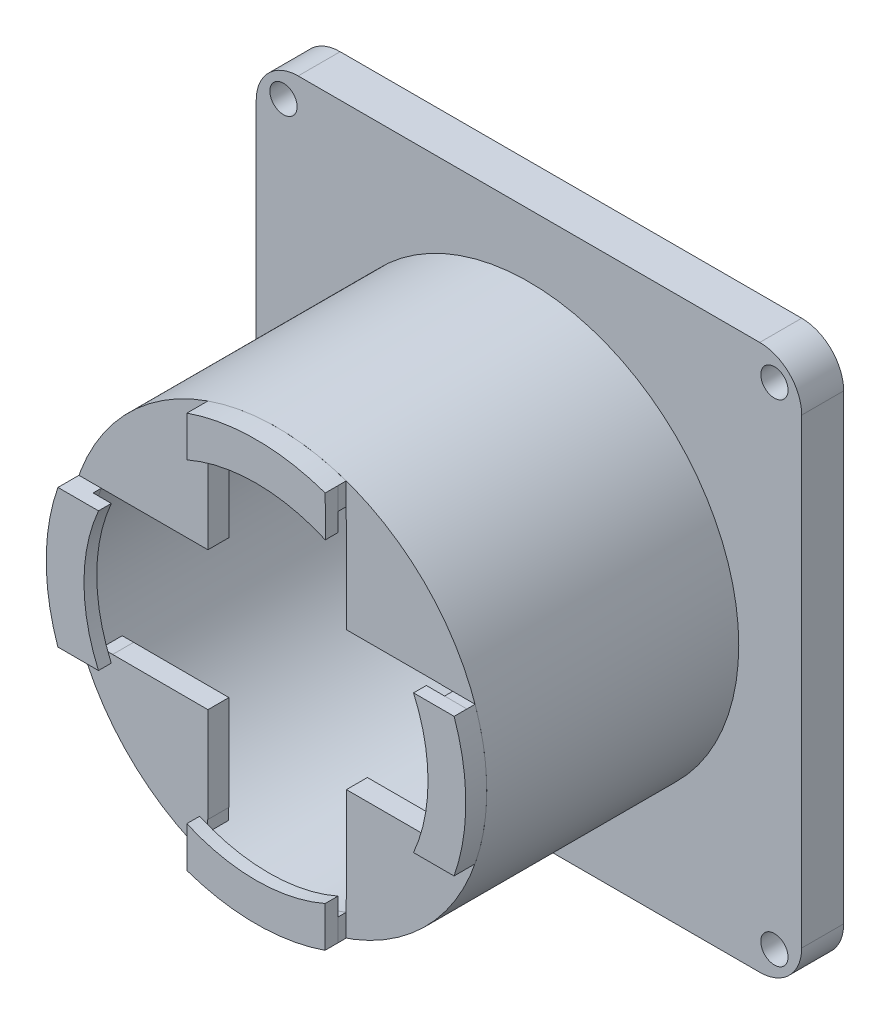
from build123d import *
from build123d.topology import SkipClean

# Parameters (mm, degrees)
DODANIE_WYCI_GNI_CIE2_DEPTH = 10
SZKIC2_R                    = 50
SZKIC2_R_2                  = 45
DODANIE_WYCI_GNI_CIE3_DEPTH = 55.05
SZKIC4_R                    = 3.25
WYTNIJ_WYCI_GNI_CIE2_DEPTH  = 55
DODANIE_WYCI_GNI_CIE4_DEPTH = 5
SZKIC8_R                    = 45
WYTNIJ_WYCI_GNI_CIE3_DEPTH  = 110.799829235
DODANIE_WYCI_GNI_CIE5_DEPTH = 10
DODANIE_WYCI_GNI_CIE6_START = -3.05
DODANIE_WYCI_GNI_CIE6_DEPTH = 3.05
PODZIEL1_OUTLINE_R          = 3.25
PODZIEL1_OUTLINE_R_2        = 45
PODZIEL1_DEPTH              = 10
PODZIEL1_2_OUTLINE_R        = 3.25
PODZIEL1_2_DEPTH            = 10
PODZIEL1_START              = 70.05
PODZIEL1_3_OUTLINE_R        = 3.25
PODZIEL1_3_DEPTH            = 5
PODZIEL1_START_2            = 72
PODZIEL1_4_DEPTH            = 3.05
PODZIEL1_5_DEPTH            = 1.95
PODZIEL1_6_DEPTH            = 3.05
PODZIEL1_7_DEPTH            = 1.95
PODZIEL1_8_DEPTH            = 3.05
PODZIEL1_9_DEPTH            = 1.95
PODZIEL1_10_DEPTH           = 3.05
PODZIEL1_11_DEPTH           = 1.95


# Read off the part's stored shape, not the designer's step: Podziel1
with BuildPart() as part:
    # Szkic1 → Dodanie-wyciągnięcie2 (new body)
    with BuildSketch(Plane.XY):
        with BuildLine():
            Line((-55, 65), (55, 65))
            ThreePointArc((55, 65), (62.071067812, 62.071067812), (65, 55))
            Line((65, 55), (65, -55))
            ThreePointArc((65, -55), (62.071067812, -62.071067812), (55, -65))
            Line((55, -65), (-55, -65))
            ThreePointArc((-55, -65), (-62.071067812, -62.071067812), (-65, -55))
            Line((-65, -55), (-65, 55))
            ThreePointArc((-65, 55), (-62.071067812, 62.071067812), (-55, 65))
        make_face()
    extrude(amount=DODANIE_WYCI_GNI_CIE2_DEPTH)

    # Szkic2 → Dodanie-wyciągnięcie3 (add)
    with BuildSketch(Plane.XY.offset(10)):
        Circle(SZKIC2_R)
        Circle(SZKIC2_R_2, mode=Mode.SUBTRACT)
    extrude(amount=DODANIE_WYCI_GNI_CIE3_DEPTH)

    # Szkic4 → Wytnij-wyciągnięcie2 (cut)
    with BuildSketch(Plane.XY.offset(10)):
        with Locations((-58.5, 58.5)):
            Circle(SZKIC4_R)
        with Locations((58.5, 58.5)):
            Circle(SZKIC4_R)
        with Locations((58.5, -58.5)):
            Circle(SZKIC4_R)
        with Locations((-58.5, -58.5)):
            Circle(SZKIC4_R)
    extrude(amount=-WYTNIJ_WYCI_GNI_CIE2_DEPTH, mode=Mode.SUBTRACT)

    # Szkic7 → Dodanie-wyciągnięcie4 (add)
    with BuildSketch(Plane.XY.offset(65.05)):
        with BuildLine():
            Line((-16.455530898, 16.5), (-16.455530898, 47.214568757))
            ThreePointArc((-16.455530898, 47.214568757), (-35.338682666, 35.371987609), (-47.199046601, 16.5))
            Line((-47.199046601, 16.5), (-16.455530898, 16.5))
        make_face()
        with BuildLine():
            ThreePointArc((16.5, 39.185016306), (16.522237205, 39.17567049), (16.544469102, 39.166312055))
            Line((16.544469102, 39.166312055), (16.544469102, 16.5))
            Line((16.544469102, 16.5), (39.210781157, 16.5))
            ThreePointArc((39.210781157, 16.5), (39.220139592, 16.477768103), (39.229485408, 16.455530898))
            Line((39.229485408, 16.455530898), (47.214568757, 16.455530898))
            ThreePointArc((47.214568757, 16.455530898), (35.371987609, 35.338682666), (16.5, 47.199046601))
            Line((16.5, 47.199046601), (16.5, 39.185016306))
        make_face()
        with BuildLine():
            ThreePointArc((-16.5, -39.147548354), (-16.477768113, -39.156936517), (-16.455530898, -39.166312055))
            Line((-16.455530898, -39.166312055), (-16.455530898, -16.5))
            Line((-16.455530898, -16.5), (-39.166312055, -16.455530898))
            Line((-39.166312055, -16.455530898), (-47.214568757, -16.455530898))
            ThreePointArc((-47.214568757, -16.455530898), (-35.371987609, -35.338682666), (-16.5, -47.199046601))
            Line((-16.5, -47.199046601), (-16.5, -39.147548354))
        make_face()
        with BuildLine():
            Line((16.544469102, -16.5), (16.544469102, -39.166312055))
            ThreePointArc((16.544469102, -39.166312055), (16.500010596, -39.185011856), (16.455530898, -39.20366119))
            Line((16.455530898, -39.20366119), (16.455530898, -47.214568757))
            ThreePointArc((16.455530898, -47.214568757), (35.338682666, -35.371987609), (47.199046601, -16.5))
            Line((47.199046601, -16.5), (16.544469102, -16.5))
        make_face()
    extrude(amount=DODANIE_WYCI_GNI_CIE4_DEPTH)

    # Szkic8 → Wytnij-wyciągnięcie3 (cut, through all)
    with SkipClean():  # the faces are left unmerged after this step: merging them gives an invalid solid
        with BuildSketch(Plane.XY.offset(10)):
            with Locations(Location((0, 0, 0), (0, 0, 201.449342522))):
                Circle(SZKIC8_R)
        extrude(amount=-WYTNIJ_WYCI_GNI_CIE3_DEPTH, mode=Mode.SUBTRACT)
    add(part.part.scale(1), mode=Mode.REPLACE)  # the faces are merged on a copy

    # Szkic9 → Dodanie-wyciągnięcie5 (add)
    with SkipClean():  # the faces are left unmerged after this step: merging them gives an invalid solid
        with BuildSketch(Plane.XY.offset(65.05)):
            with BuildLine():
                Line((-41.883355917, -16.455530898), (-47.214568757, -16.455530898))
                ThreePointArc((-47.214568757, -16.455530898), (-49.999994454, 0.023550151), (-47.199046601, 16.5))
                Line((-47.199046601, 16.5), (-41.865857211, 16.5))
                ThreePointArc((-41.865857211, 16.5), (-44.999993656, 0.023894067), (-41.883355917, -16.455530898))
            make_face()
            with BuildLine():
                Line((16.455530898, -41.883355917), (16.455530898, -47.214568757))
                ThreePointArc((16.455530898, -47.214568757), (-0.023550151, -49.999994454), (-16.5, -47.199046601))
                Line((-16.5, -47.199046601), (-16.5, -41.865857211))
                ThreePointArc((-16.5, -41.865857211), (-0.023894067, -44.999993656), (16.455530898, -41.883355917))
            make_face()
            with BuildLine():
                Line((41.865857211, -16.5), (47.199046601, -16.5))
                ThreePointArc((47.199046601, -16.5), (49.999994454, -0.023550151), (47.214568757, 16.455530898))
                Line((47.214568757, 16.455530898), (41.883355917, 16.455530898))
                ThreePointArc((41.883355917, 16.455530898), (44.999993656, -0.023894067), (41.865857211, -16.5))
            make_face()
            with BuildLine():
                Line((16.5, 41.865857211), (16.5, 47.199046601))
                ThreePointArc((16.5, 47.199046601), (0.023550151, 49.999994454), (-16.455530898, 47.214568757))
                Line((-16.455530898, 47.214568757), (-16.455530898, 41.883355917))
                ThreePointArc((-16.455530898, 41.883355917), (0.023894067, 44.999993656), (16.5, 41.865857211))
            make_face()
        extrude(amount=DODANIE_WYCI_GNI_CIE5_DEPTH)

    # Szkic10 → Dodanie-wyciągnięcie6 (add)
    with SkipClean():  # the faces are left unmerged after this step: merging them gives an invalid solid
        with BuildSketch(Plane.XY.offset(75.05).offset(DODANIE_WYCI_GNI_CIE6_START)):
            with BuildLine():
                Line((-37.546708344, -16.469507963), (-47.214568757, -16.455530898))
                ThreePointArc((-47.214568757, -16.455530898), (-49.999994454, 0.023550151), (-47.199046601, 16.5))
                Line((-47.199046601, 16.5), (-37.533318532, 16.5))
                ThreePointArc((-37.533318532, 16.5), (-40.999996619, 0.016651212), (-37.546708344, -16.469507963))
            make_face()
            with BuildLine():
                Line((-16.5, -47.199046601), (-16.486007616, -37.539466604))
                ThreePointArc((-16.486007616, -37.539466604), (-0.001345704, -40.999999978), (16.483543336, -37.540548732))
                Line((16.483543336, -37.540548732), (16.455530898, -47.214568757))
                ThreePointArc((16.455530898, -47.214568757), (-0.023550151, -49.999994454), (-16.5, -47.199046601))
            make_face()
            with BuildLine():
                Line((47.199046601, -16.5), (37.533318532, -16.5))
                ThreePointArc((37.533318532, -16.5), (40.999996628, -0.016629068), (37.546690554, 16.46954852))
                Line((37.546690554, 16.46954852), (47.214568757, 16.455530898))
                ThreePointArc((47.214568757, 16.455530898), (49.999994454, -0.023550151), (47.199046601, -16.5))
            make_face()
            with BuildLine():
                Line((-16.455530898, 47.214568757), (-16.455530898, 37.552836149))
                ThreePointArc((-16.455530898, 37.552836149), (0.031934624, 40.999987563), (16.514010216, 37.527156388))
                Line((16.514010216, 37.527156388), (16.5, 47.199046601))
                ThreePointArc((16.5, 47.199046601), (0.023550151, 49.999994454), (-16.455530898, 47.214568757))
            make_face()
        extrude(amount=DODANIE_WYCI_GNI_CIE6_DEPTH)

    # Podziel1 2 outline → Podziel1 2 (cut)
    with SkipClean():  # the faces are left unmerged after this step: merging them gives an invalid solid
        with BuildSketch(Plane.XY):
            with BuildLine():
                ThreePointArc((-65, -55), (-62.071067812, -62.071067812), (-55, -65))
                Line((-55, -65), (55, -65))
                ThreePointArc((55, -65), (62.071067812, -62.071067812), (65, -55))
                Line((65, -55), (65, 55))
                ThreePointArc((65, 55), (62.071067812, 62.071067812), (55, 65))
                Line((55, 65), (-55, 65))
                ThreePointArc((-55, 65), (-62.071067812, 62.071067812), (-65, 55))
                Line((-65, 55), (-65, -55))
            make_face()
            with BuildLine():
                ThreePointArc((41.865857211, -16.5), (17.936369644, -41.270893424), (-16.5, -41.865857211))
                ThreePointArc((-16.5, -41.865857211), (-41.270893424, -17.936369644), (-41.865857211, 16.5))
                ThreePointArc((-41.865857211, 16.5), (-31.802905011, 31.836696325), (-16.455530898, 41.883355917))
                ThreePointArc((-16.455530898, 41.883355917), (31.836696325, 31.802905011), (41.865857211, -16.5))
            make_face(mode=Mode.SUBTRACT)
            with Locations((-58.5, -58.5)):
                Circle(PODZIEL1_2_OUTLINE_R, mode=Mode.SUBTRACT)
            with Locations((58.5, -58.5)):
                Circle(PODZIEL1_2_OUTLINE_R, mode=Mode.SUBTRACT)
            with Locations((-58.5, 58.5)):
                Circle(PODZIEL1_2_OUTLINE_R, mode=Mode.SUBTRACT)
            with Locations((58.5, 58.5)):
                Circle(PODZIEL1_2_OUTLINE_R, mode=Mode.SUBTRACT)
        extrude(amount=PODZIEL1_2_DEPTH, mode=Mode.SUBTRACT)

    # Podziel1 3 outline → Podziel1 3 (cut)
    with SkipClean():  # the faces are left unmerged after this step: merging them gives an invalid solid
        with BuildSketch(Plane.XY.offset(PODZIEL1_START)):
            with BuildLine():
                ThreePointArc((-65, -55), (-62.071067812, -62.071067812), (-55, -65))
                Line((-55, -65), (55, -65))
                ThreePointArc((55, -65), (62.071067812, -62.071067812), (65, -55))
                Line((65, -55), (65, 55))
                ThreePointArc((65, 55), (62.071067812, 62.071067812), (55, 65))
                Line((55, 65), (-55, 65))
                ThreePointArc((-55, 65), (-62.071067812, 62.071067812), (-65, 55))
                Line((-65, 55), (-65, -55))
            make_face()
            with BuildLine():
                Line((37.533318532, -16.5), (41.865857211, -16.5))
                ThreePointArc((41.865857211, -16.5), (31.808778722, -31.830827765), (16.47098574, -41.87728058))
                Line((16.47098574, -41.87728058), (16.483543336, -37.540548732))
                ThreePointArc((16.483543336, -37.540548732), (-0.001345704, -40.999999978), (-16.486007616, -37.539466604))
                Line((-16.486007616, -37.539466604), (-16.492279016, -41.868899351))
                ThreePointArc((-16.492279016, -41.868899351), (-16.496139578, -41.867378459), (-16.5, -41.865857211))
                ThreePointArc((-16.5, -41.865857211), (-31.8337682, -31.805835977), (-41.880325193, -16.463242746))
                Line((-41.880325193, -16.463242746), (-37.546708344, -16.469507963))
                ThreePointArc((-37.546708344, -16.469507963), (-40.999996619, 0.016651212), (-37.533318532, 16.5))
                Line((-37.533318532, 16.5), (-41.865857211, 16.5))
                ThreePointArc((-41.865857211, 16.5), (-31.802905011, 31.836696325), (-16.455530898, 41.883355917))
                Line((-16.455530898, 41.883355917), (-16.455530898, 37.552836149))
                ThreePointArc((-16.455530898, 37.552836149), (0.031934624, 40.999987563), (16.514010216, 37.527156388))
                Line((16.514010216, 37.527156388), (16.507729805, 41.862809947))
                ThreePointArc((16.507729805, 41.862809947), (31.836695874, 31.802905462), (41.880316397, 16.463265122))
                Line((41.880316397, 16.463265122), (37.546690554, 16.46954852))
                ThreePointArc((37.546690554, 16.46954852), (40.999996628, -0.016629068), (37.533318532, -16.5))
            make_face(mode=Mode.SUBTRACT)
            with Locations((-58.5, -58.5)):
                Circle(PODZIEL1_3_OUTLINE_R, mode=Mode.SUBTRACT)
            with Locations((58.5, -58.5)):
                Circle(PODZIEL1_3_OUTLINE_R, mode=Mode.SUBTRACT)
            with Locations((-58.5, 58.5)):
                Circle(PODZIEL1_3_OUTLINE_R, mode=Mode.SUBTRACT)
            with Locations((58.5, 58.5)):
                Circle(PODZIEL1_3_OUTLINE_R, mode=Mode.SUBTRACT)
        extrude(amount=PODZIEL1_3_DEPTH, mode=Mode.SUBTRACT)


with BuildPart() as body_2:
    # Podziel1 outline → Podziel1 (new body)
    with BuildSketch(Plane.XY):
        with BuildLine():
            Line((-55, -65), (55, -65))
            ThreePointArc((55, -65), (62.071067812, -62.071067812), (65, -55))
            Line((65, -55), (65, 55))
            ThreePointArc((65, 55), (62.071067812, 62.071067812), (55, 65))
            Line((55, 65), (-55, 65))
            ThreePointArc((-55, 65), (-62.071067812, 62.071067812), (-65, 55))
            Line((-65, 55), (-65, -55))
            ThreePointArc((-65, -55), (-62.071067812, -62.071067812), (-55, -65))
        make_face()
        with Locations((-58.5, -58.5)):
            Circle(PODZIEL1_OUTLINE_R, mode=Mode.SUBTRACT)
        with Locations((58.5, -58.5)):
            Circle(PODZIEL1_OUTLINE_R, mode=Mode.SUBTRACT)
        with Locations((-58.5, 58.5)):
            Circle(PODZIEL1_OUTLINE_R, mode=Mode.SUBTRACT)
        Circle(PODZIEL1_OUTLINE_R_2, mode=Mode.SUBTRACT)
        with Locations((58.5, 58.5)):
            Circle(PODZIEL1_OUTLINE_R, mode=Mode.SUBTRACT)
    extrude(amount=PODZIEL1_DEPTH)


with BuildPart() as body_3:
    # Podziel1 4 outline → Podziel1 4 (new body)
    with BuildSketch(Plane.XY.offset(PODZIEL1_START_2)):
        with BuildLine():
            Line((37.533318532, -16.5), (47.199046601, -16.5))
            ThreePointArc((47.199046601, -16.5), (49.999994454, -0.023550151), (47.214568757, 16.455530898))
            Line((47.214568757, 16.455530898), (37.546690554, 16.46954852))
            ThreePointArc((37.546690554, 16.46954852), (40.999996628, -0.016629068), (37.533318532, -16.5))
        make_face()
    extrude(amount=PODZIEL1_4_DEPTH)

    # Podziel1 5 outline → Podziel1 5 (add)
    with BuildSketch(Plane.XY.offset(PODZIEL1_START)):
        with BuildLine():
            ThreePointArc((47.199046601, -16.5), (49.999994454, -0.023550151), (47.214568757, 16.455530898))
            Line((47.214568757, 16.455530898), (41.883355917, 16.455530898))
            ThreePointArc((41.883355917, 16.455530898), (44.999993656, -0.023894067), (41.865857211, -16.5))
            Line((41.865857211, -16.5), (47.199046601, -16.5))
        make_face()
    extrude(amount=PODZIEL1_5_DEPTH)


with BuildPart() as body_4:
    # Podziel1 6 outline → Podziel1 6 (new body)
    with BuildSketch(Plane.XY.offset(PODZIEL1_START_2)):
        with BuildLine():
            ThreePointArc((16.483543336, -37.540548732), (-0.001345704, -40.999999978), (-16.486007616, -37.539466604))
            Line((-16.486007616, -37.539466604), (-16.492279016, -41.868899351))
            ThreePointArc((-16.492279016, -41.868899351), (-16.496139578, -41.867378459), (-16.5, -41.865857211))
            Line((-16.5, -41.865857211), (-16.5, -47.199046601))
            ThreePointArc((-16.5, -47.199046601), (-0.023550151, -49.999994454), (16.455530898, -47.214568757))
            Line((16.455530898, -47.214568757), (16.483543336, -37.540548732))
        make_face()
    extrude(amount=PODZIEL1_6_DEPTH)

    # Podziel1 7 outline → Podziel1 7 (add)
    with BuildSketch(Plane.XY.offset(PODZIEL1_START)):
        with BuildLine():
            ThreePointArc((16.455530898, -41.883355917), (-0.023894067, -44.999993656), (-16.5, -41.865857211))
            Line((-16.5, -41.865857211), (-16.5, -47.199046601))
            ThreePointArc((-16.5, -47.199046601), (-0.023550151, -49.999994454), (16.455530898, -47.214568757))
            Line((16.455530898, -47.214568757), (16.455530898, -41.883355917))
        make_face()
    extrude(amount=PODZIEL1_7_DEPTH)


with BuildPart() as body_5:
    # Podziel1 8 outline → Podziel1 8 (new body)
    with BuildSketch(Plane.XY.offset(PODZIEL1_START_2)):
        with BuildLine():
            Line((-37.533318532, 16.5), (-47.199046601, 16.5))
            ThreePointArc((-47.199046601, 16.5), (-49.999994454, 0.023550151), (-47.214568757, -16.455530898))
            Line((-47.214568757, -16.455530898), (-37.546708344, -16.469507963))
            ThreePointArc((-37.546708344, -16.469507963), (-40.999996619, 0.016651212), (-37.533318532, 16.5))
        make_face()
    extrude(amount=PODZIEL1_8_DEPTH)

    # Podziel1 9 outline → Podziel1 9 (add)
    with BuildSketch(Plane.XY.offset(PODZIEL1_START)):
        with BuildLine():
            ThreePointArc((-47.199046601, 16.5), (-49.999994454, 0.023550151), (-47.214568757, -16.455530898))
            Line((-47.214568757, -16.455530898), (-41.883355917, -16.455530898))
            ThreePointArc((-41.883355917, -16.455530898), (-44.999993656, 0.023894067), (-41.865857211, 16.5))
            Line((-41.865857211, 16.5), (-47.199046601, 16.5))
        make_face()
    extrude(amount=PODZIEL1_9_DEPTH)


with BuildPart() as body_6:
    # Podziel1 10 outline → Podziel1 10 (new body)
    with BuildSketch(Plane.XY.offset(PODZIEL1_START_2)):
        with BuildLine():
            ThreePointArc((-16.455530898, 37.552836149), (0.031934624, 40.999987563), (16.514010216, 37.527156388))
            Line((16.514010216, 37.527156388), (16.5, 47.199046601))
            ThreePointArc((16.5, 47.199046601), (0.023550151, 49.999994454), (-16.455530898, 47.214568757))
            Line((-16.455530898, 47.214568757), (-16.455530898, 37.552836149))
        make_face()
    extrude(amount=PODZIEL1_10_DEPTH)

    # Podziel1 11 outline → Podziel1 11 (add)
    with BuildSketch(Plane.XY.offset(PODZIEL1_START)):
        with BuildLine():
            Line((16.5, 41.865857211), (16.5, 47.199046601))
            ThreePointArc((16.5, 47.199046601), (0.023550151, 49.999994454), (-16.455530898, 47.214568757))
            Line((-16.455530898, 47.214568757), (-16.455530898, 41.883355917))
            ThreePointArc((-16.455530898, 41.883355917), (0.023894067, 44.999993656), (16.5, 41.865857211))
        make_face()
    extrude(amount=PODZIEL1_11_DEPTH)


solid = Compound([part.part, body_2.part, body_3.part, body_4.part, body_5.part, body_6.part])
